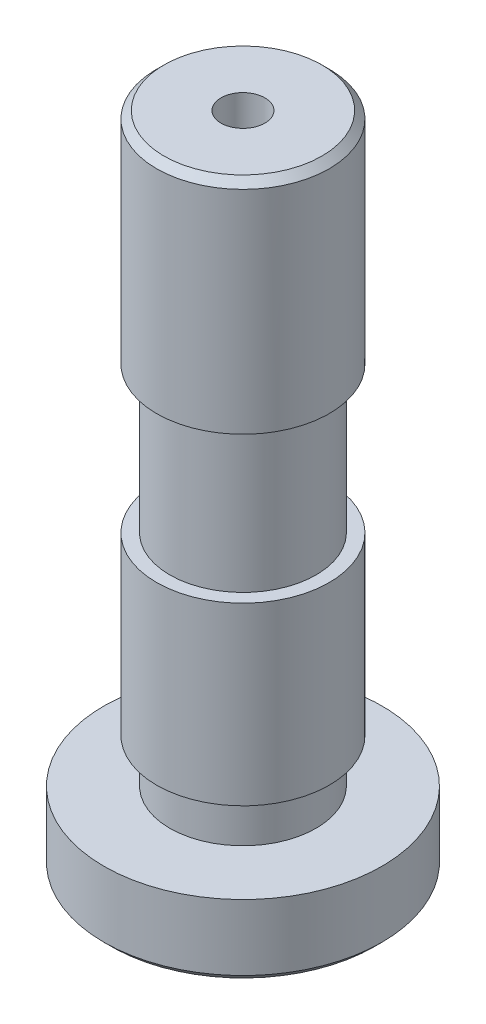
from build123d import *

# Parameters (mm, degrees)
SKETCH_2_R          = 1.5
CUT_EXTRUDE_1_DEPTH = 3
CUT_EXTRUDE_START   = -3
SKETCH_3_R          = 1.5
CUT_EXTRUDE_2_DEPTH = 3
CHAMFER_1_SIZE      = 0.5


with BuildPart() as part:
    # Эскиз1 → Повернуть1 (revolve)
    with BuildSketch(Plane.XY):
        Polygon((0, 0), (9.5, 0), (9.5, 5), (5, 5), (5, 8), (5.9, 8), (5.9, 20), (5, 20), (5, 30), (5.9, 30), (5.9, 45), (0, 45), align=None)
    revolve(axis=Axis((0, 14.6467512, 0), (0, -1, 0)))

    # Эскиз2 → Вырез-Вытянуть1 (cut)
    with BuildSketch(Plane(origin=(0, 45, 0), x_dir=(1, 0, 0), z_dir=(0, 1, 0))):
        Circle(SKETCH_2_R)
    extrude(amount=-CUT_EXTRUDE_1_DEPTH, mode=Mode.SUBTRACT)

    # Эскиз3 → Вырез-Вытянуть2 (cut)
    with BuildSketch(Plane(origin=(0, 0, 0), x_dir=(-1, 0, 0), z_dir=(0, -1, 0)).offset(CUT_EXTRUDE_START)):
        Circle(SKETCH_3_R)
    extrude(amount=CUT_EXTRUDE_2_DEPTH, mode=Mode.SUBTRACT)

    # Фаска1
    chamfer_1_edges = [part.edges().sort_by_distance(p)[0] for p in [
        (-9.5, 0, 0),
        (-5.9, 45, 0),
    ]]
    chamfer(chamfer_1_edges, length=CHAMFER_1_SIZE)


solid = part.part
